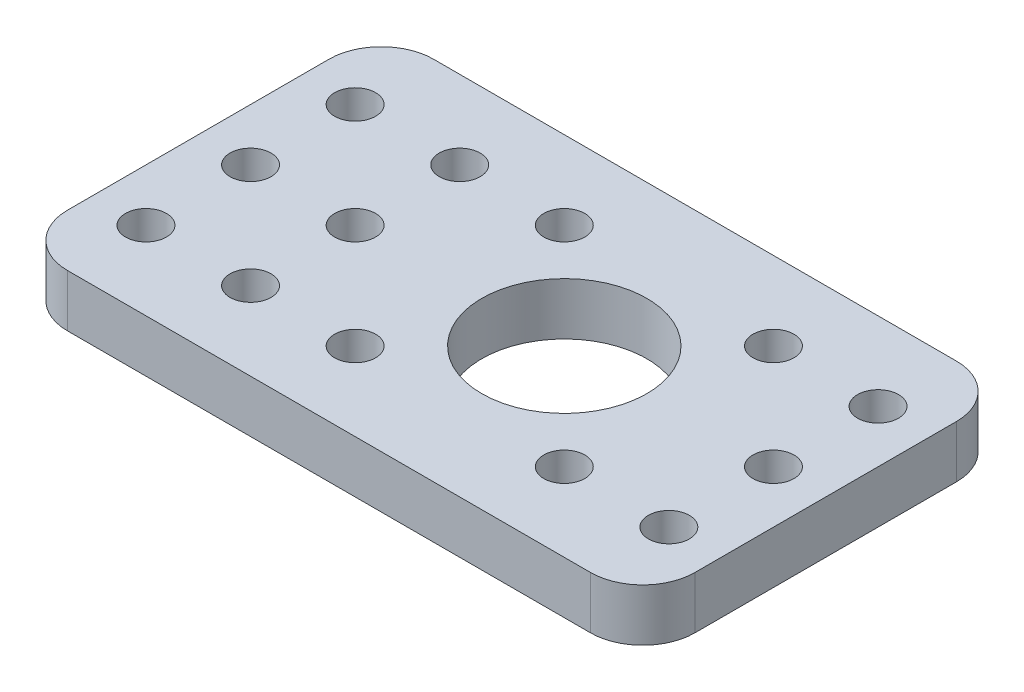
from build123d import *

# Parameters (mm, degrees)
SKETCH1_W           = 76.2
SKETCH1_H           = 44.45
BOSS_EXTRUDE1_DEPTH = 6.35
FILLET1_R           = 6.35
SKETCH2_R           = 2.4892
SKETCH2_R_2         = 10.025399939
CUT_EXTRUDE1_DEPTH  = 89.44526556


with BuildPart() as part:
    # Sketch1 → Boss-Extrude1 (new body)
    with BuildSketch(Plane(origin=(0, 0, 0), x_dir=(1, 0, 0), z_dir=(0, 1, 0))):
        with Locations((38.1, 22.225)):
            Rectangle(SKETCH1_W, SKETCH1_H)
    extrude(amount=BOSS_EXTRUDE1_DEPTH)

    # Fillet1
    fillet1_edges = [part.edges().sort_by_distance(p)[0] for p in [
        (0, 3.175, -44.45),
        (76.2, 3.175, -44.45),
        (0, 3.175, 0),
        (76.2, 3.175, 0),
    ]]
    fillet(fillet1_edges, radius=FILLET1_R)

    # Sketch2 → Cut-Extrude1 (cut, through all)
    with BuildSketch(Plane(origin=(0, 6.35, 0), x_dir=(1, 0, 0), z_dir=(0, 1, 0))):
        with Locations((31.75, 34.925)):
            Circle(SKETCH2_R)
        with Locations((6.35, 34.925)):
            Circle(SKETCH2_R)
        with Locations((19.05, 34.925)):
            Circle(SKETCH2_R)
        with Locations((19.05, 22.225)):
            Circle(SKETCH2_R)
        with Locations((6.35, 22.225)):
            Circle(SKETCH2_R)
        with Locations((6.35, 9.525)):
            Circle(SKETCH2_R)
        with Locations((19.05, 9.525)):
            Circle(SKETCH2_R)
        with Locations((31.75, 9.525)):
            Circle(SKETCH2_R)
        with Locations((57.15, 9.525)):
            Circle(SKETCH2_R)
        with Locations((69.85, 9.525)):
            Circle(SKETCH2_R)
        with Locations((69.85, 22.225)):
            Circle(SKETCH2_R)
        with Locations((69.85, 34.925)):
            Circle(SKETCH2_R)
        with Locations((57.15, 34.925)):
            Circle(SKETCH2_R)
        with Locations((44.45, 22.225)):
            Circle(SKETCH2_R_2)
    extrude(amount=-CUT_EXTRUDE1_DEPTH, mode=Mode.SUBTRACT)


solid = part.part
